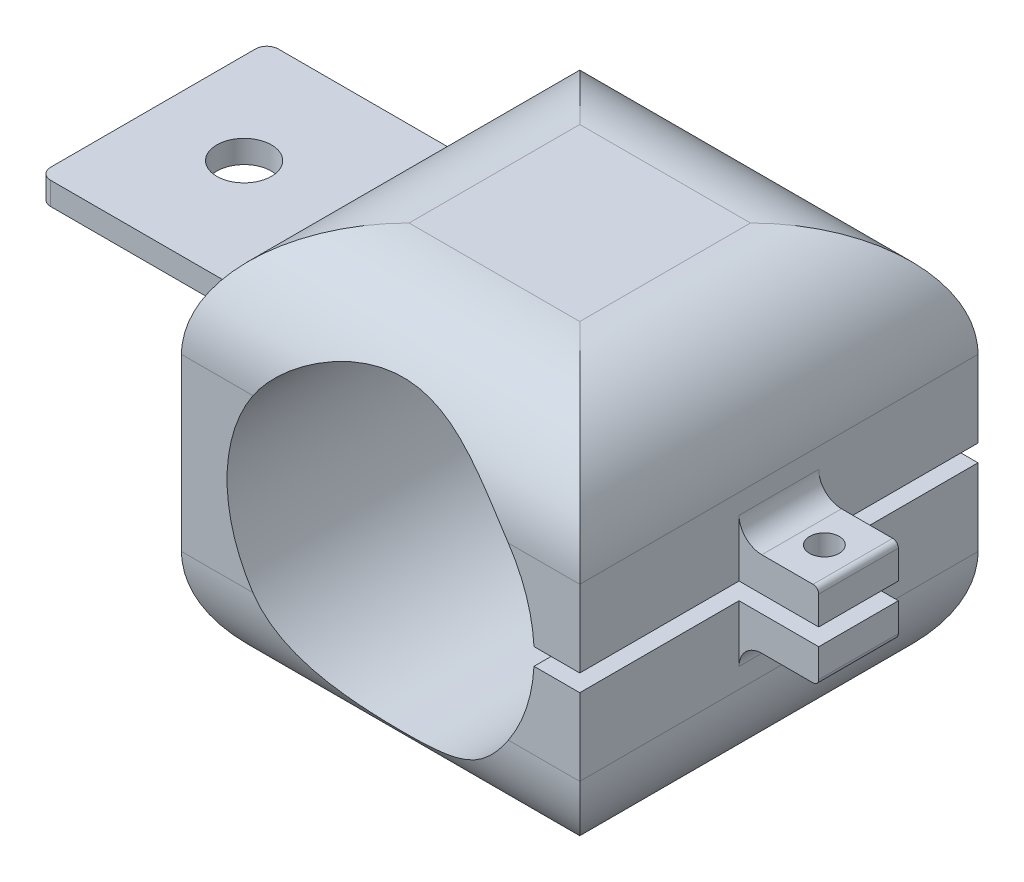
from build123d import *

# Parameters (mm, degrees)
BOSS_EXTRUDE1_DEPTH  = 35
SKETCH3_W            = 7
SKETCH3_H            = 7
BOSS_EXTRUDE2_DEPTH  = 3
FILLET1_R            = 2
FILLET2_R            = 0.5
M2_CLEARANCE_HOLE1_D = 2.6
FILLET3_R            = 0.5
FILLET4_R            = 2
FILLET5_R            = 10
SKETCH8_W            = 20
SKETCH8_H            = 2
BOSS_EXTRUDE4_DEPTH  = 20
M4_CLEARANCE_HOLE1_D = 4.8
FILLET6_R            = 3
FILLET7_R            = 1


with BuildPart() as part:
    # Sketch1 → Boss-Extrude1 (new body)
    with BuildSketch(Plane.XY):
        with BuildLine():
            Line((13.479150567, 0.75), (17.5, 0.75))
            Line((17.5, 0.75), (17.5, 17.5))
            Line((17.5, 17.5), (-17.5, 17.5))
            Line((-17.5, 17.5), (-17.5, -17.5))
            Line((-17.5, -17.5), (17.5, -17.5))
            Line((17.5, -17.5), (17.5, -0.75))
            Line((17.5, -0.75), (13.479150567, -0.75))
            ThreePointArc((13.479150567, -0.75), (-13.5, 0), (13.479150567, 0.75))
        make_face()
    extrude(amount=BOSS_EXTRUDE1_DEPTH)

    # Sketch3 → Boss-Extrude2 (add)
    with BuildSketch(Plane.XZ.offset(-0.75)):
        with Locations((21, 17.5)):
            Rectangle(SKETCH3_W, SKETCH3_H)
    boss_extrude2 = extrude(amount=-BOSS_EXTRUDE2_DEPTH)

    # Fillet1
    fillet1_edges = [part.edges().sort_by_distance(p)[0] for p in [
        (17.5, 3.75, 17.5),
    ]]
    fillet(fillet1_edges, radius=FILLET1_R)

    # Fillet2
    fillet2_edges = [part.edges().sort_by_distance(p)[0] for p in [
        (24.5, 3.75, 17.5),
    ]]
    fillet(fillet2_edges, radius=FILLET2_R)

    # M2 Clearance Hole1 (through all)
    with Locations(Plane(origin=(0, 3.75, 0), x_dir=(1, 0, 0), z_dir=(0, 1, 0))):
        with Locations((21.5, -17.5)):
            m2_clearance_hole1 = Hole(M2_CLEARANCE_HOLE1_D / 2)

    # Mirror3: Boss-Extrude2 across plane
    add(boss_extrude2.mirror(Plane.ZX))

    # Mirror5: M2 Clearance Hole1 across plane
    add(m2_clearance_hole1.mirror(Plane.ZX), mode=Mode.SUBTRACT)

    # Fillet3
    fillet3_edges = [part.edges().sort_by_distance(p)[0] for p in [
        (24.5, -3.75, 17.5),
    ]]
    fillet(fillet3_edges, radius=FILLET3_R)

    # Fillet4
    fillet4_edges = [part.edges().sort_by_distance(p)[0] for p in [
        (17.5, -3.75, 17.5),
    ]]
    fillet(fillet4_edges, radius=FILLET4_R)

    # Fillet5
    # the kernel refuses this fillet: 10 mm, written as the material it takes off along each edge
    with BuildSketch(Plane(origin=(-42.5, -17.5, 0), x_dir=(0, 0, 1), z_dir=(1, 0, 0)), Plane(origin=(17.5, -17.5, -25), x_dir=(-1, 0, 0), z_dir=(0, 0, 1)), Plane(origin=(42.5, 17.5, 35), x_dir=(0, -1, 0), z_dir=(-1, 0, 0)), Plane(origin=(42.5, 17.5, 0), x_dir=(0, 0, 1), z_dir=(-1, 0, 0)), Plane(origin=(-42.5, -17.5, 35), x_dir=(0, 1, 0), z_dir=(1, 0, 0))) as fillet5_piece_1:
        with BuildLine():
            CenterArc((FILLET5_R, -FILLET5_R), FILLET5_R, 90, 90)
            Line((0, -FILLET5_R), (0, 0))
            Line((0, 0), (FILLET5_R, 0))
        make_face()
    extrude(amount=85, mode=Mode.SUBTRACT)
    with BuildSketch(Plane(origin=(-17.5, 17.5, -25), x_dir=(0, -1, 0), z_dir=(0, 0, 1)), Plane(origin=(17.5, 17.5, -25), x_dir=(-1, 0, 0), z_dir=(0, 0, 1)), Plane(origin=(-17.5, -17.5, -25), x_dir=(1, 0, 0), z_dir=(0, 0, 1))) as fillet5_piece_2:
        with BuildLine():
            CenterArc((FILLET5_R, FILLET5_R), FILLET5_R, 180, 90)
            Line((0, FILLET5_R), (0, 0))
            Line((0, 0), (FILLET5_R, 0))
        make_face()
    extrude(amount=85, mode=Mode.SUBTRACT)

    # Sketch8 → Boss-Extrude4 (add)
    with BuildSketch(Plane.ZY.offset(17.5)):
        with Locations((17.5, 6.5)):
            Rectangle(SKETCH8_W, SKETCH8_H)
    extrude(amount=BOSS_EXTRUDE4_DEPTH)

    # M4 Clearance Hole1 (through all)
    with Locations(Plane(origin=(0, 7.5, 0), x_dir=(1, 0, 0), z_dir=(0, 1, 0))):
        with Locations((-29.5, -17.5)):
            Hole(M4_CLEARANCE_HOLE1_D / 2)

    # Fillet6
    fillet6_edges = [part.edges().sort_by_distance(p)[0] for p in [
        (-17.5, 5.5, 17.5),
        (-17.5, 7.5, 17.5),
    ]]
    fillet(fillet6_edges, radius=FILLET6_R)

    # Fillet7
    fillet7_edges = [part.edges().sort_by_distance(p)[0] for p in [
        (-37.5, 6.5, 7.5),
        (-37.5, 6.5, 27.5),
    ]]
    fillet(fillet7_edges, radius=FILLET7_R)


solid = part.part
